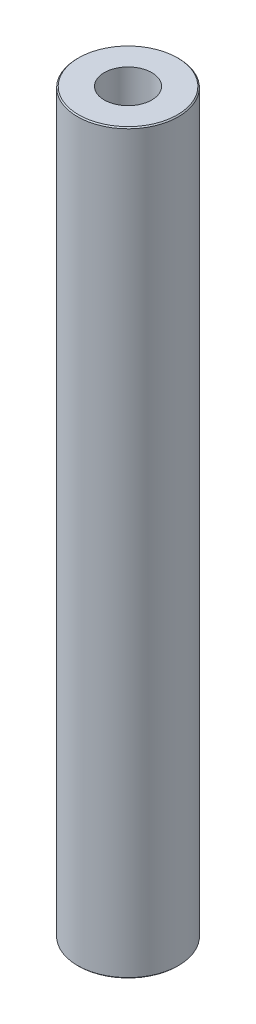
from build123d import *

# Parameters (mm, degrees)
SKETCH1_R           = 40
BOSS_EXTRUDE1_DEPTH = 583.947641491
SKETCH2_R           = 18.819052655
CUT_EXTRUDE1_DEPTH  = 587.681214974
CHAMFER1_SIZE       = 0.871751243


with BuildPart() as part:
    # Sketch1 → Boss-Extrude1 (new body)
    with BuildSketch(Plane(origin=(0, 0, 0), x_dir=(1, 0, 0), z_dir=(0, 1, 0))):
        Circle(SKETCH1_R)
    extrude(amount=BOSS_EXTRUDE1_DEPTH)

    # Sketch2 → Cut-Extrude1 (cut, through all)
    with BuildSketch(Plane(origin=(0, 0, 0), x_dir=(1, 0, 0), z_dir=(0, 1, 0))):
        Circle(SKETCH2_R)
    extrude(amount=CUT_EXTRUDE1_DEPTH, mode=Mode.SUBTRACT)

    # Chamfer1
    chamfer1_edges = [part.edges().sort_by_distance(p)[0] for p in [
        (-40, 583.947641491, 0),
        (-40, 0, 0),
    ]]
    chamfer(chamfer1_edges, length=CHAMFER1_SIZE)


solid = part.part
